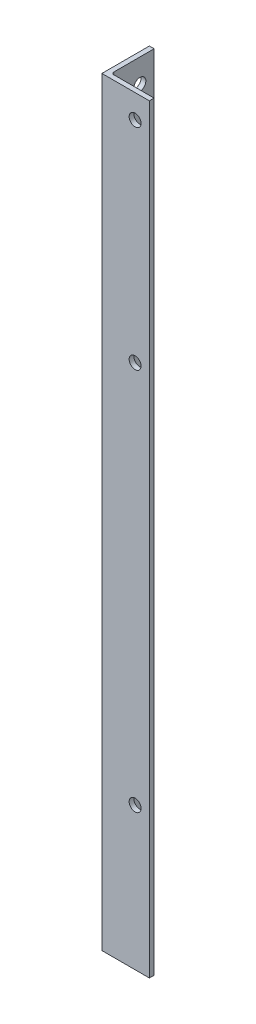
from build123d import *

# Parameters (mm, degrees)
BOSS_EXTRUDE1_DEPTH               = 508
RIGHTSIDEHOLES_SKETCH3_R          = 4
RIGHTSIDEHOLES_CUT_EXTRUDE1_DEPTH = 3.175
FRONTSIDEHOLES_SKETCH4_R          = 4
FRONTSIDEHOLES_SKETCH4_R_2        = 2
FRONTSIDEHOLES_CUT_EXTRUDE2_DEPTH = 3.175


with BuildPart() as part:
    # Sketch2 → Boss-Extrude1 (new body)
    with BuildSketch(Plane(origin=(0, 0, 0), x_dir=(1, 0, 0), z_dir=(0, 1, 0))):
        with BuildLine():
            Line((0, 31.75), (3.175, 31.75))
            Line((3.175, 31.75), (3.175, 4.7625))
            ThreePointArc((3.175, 4.7625), (3.639967985, 3.639967985), (4.7625, 3.175))
            Line((4.7625, 3.175), (31.75, 3.175))
            Line((31.75, 3.175), (31.75, 0))
            Line((31.75, 0), (0, 0))
            Line((0, 0), (0, 31.75))
        make_face()
    extrude(amount=BOSS_EXTRUDE1_DEPTH)

    # RightSideHoles-Sketch3 → RightSideHoles-Cut-Extrude1 (cut)
    with BuildSketch(Plane.XY):
        with Locations((22.225, 95.4)):
            Circle(RIGHTSIDEHOLES_SKETCH3_R)
        with Locations((22.225, 492.125)):
            Circle(RIGHTSIDEHOLES_SKETCH3_R)
        with Locations((22.225, 351.58487)):
            Circle(RIGHTSIDEHOLES_SKETCH3_R)
    extrude(amount=-RIGHTSIDEHOLES_CUT_EXTRUDE1_DEPTH, mode=Mode.SUBTRACT)

    # FrontSideHoles-Sketch4 → FrontSideHoles-Cut-Extrude2 (cut)
    with BuildSketch(Plane.ZY):
        with Locations((-22.225, 95.4)):
            Circle(FRONTSIDEHOLES_SKETCH4_R)
        with Locations((-22.225, 492.125)):
            Circle(FRONTSIDEHOLES_SKETCH4_R)
        with Locations((-17.4625, 406.13487)):
            Circle(FRONTSIDEHOLES_SKETCH4_R_2)
        with Locations((-17.4625, 365.93487)):
            Circle(FRONTSIDEHOLES_SKETCH4_R_2)
    extrude(amount=-FRONTSIDEHOLES_CUT_EXTRUDE2_DEPTH, mode=Mode.SUBTRACT)


solid = part.part
